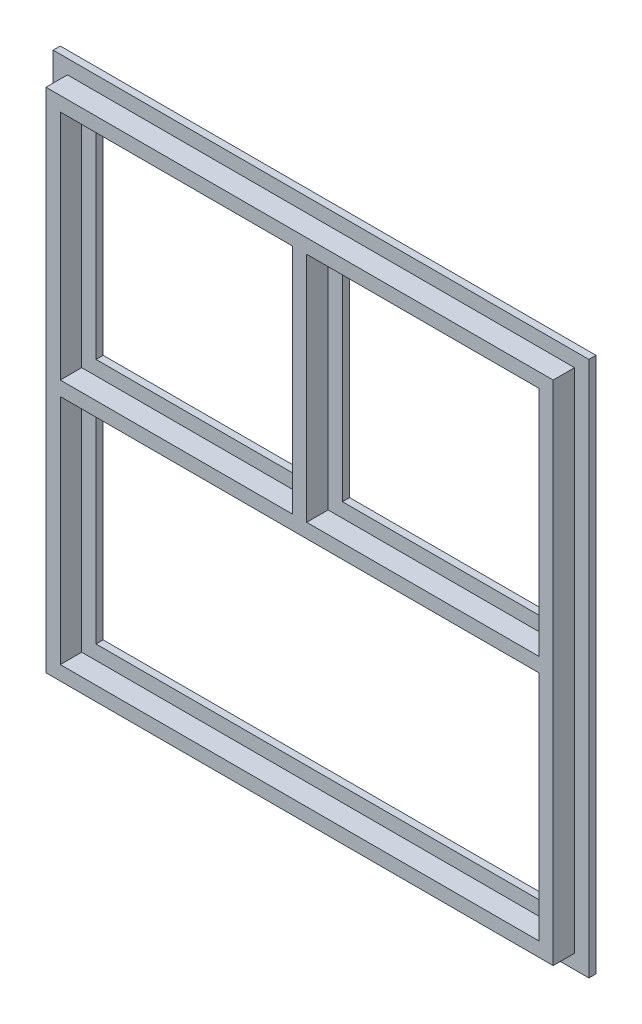
from build123d import *

# Parameters (mm, degrees)
ESBO_O1_W                = 75
ESBO_O1_H                = 75
RESSALTO_EXTRUS_O1_DEPTH = 1
ESBO_O2_W                = 71
ESBO_O2_H                = 71
ESBO_O2_W_2              = 67
ESBO_O2_H_2              = 67
RESSALTO_EXTRUS_O2_DEPTH = 3
ESBO_O3_W                = 28.5
ESBO_O3_H                = 28.5
ESBO_O3_W_2              = 63
CORTE_EXTRUS_O2_DEPTH    = 3
RESSALTO_EXTRUS_O3_DEPTH = 3


with BuildPart() as part:
    # Esboço1 → Ressalto-extrusão1 (new body)
    with BuildSketch(Plane.XY):
        Rectangle(ESBO_O1_W, ESBO_O1_H)
    extrude(amount=RESSALTO_EXTRUS_O1_DEPTH)

    # Esboço2 → Ressalto-extrusão2 (add)
    with BuildSketch(Plane.XY.offset(1)):
        Rectangle(ESBO_O2_W, ESBO_O2_H)
        Rectangle(ESBO_O2_W_2, ESBO_O2_H_2, mode=Mode.SUBTRACT)
    extrude(amount=RESSALTO_EXTRUS_O2_DEPTH)

    # Esboço3 → Corte-extrusão2 (cut)
    with BuildSketch(Plane.XY.offset(1)):
        with Locations((17.25, 17.25)):
            Rectangle(ESBO_O3_W, ESBO_O3_H)
        with Locations((0, -17.25)):
            Rectangle(ESBO_O3_W_2, ESBO_O3_H)
        with Locations((-17.25, 17.25)):
            Rectangle(ESBO_O3_W, ESBO_O3_H)
    extrude(amount=-CORTE_EXTRUS_O2_DEPTH, mode=Mode.SUBTRACT)

    # Esboço4 → Ressalto-extrusão3 (add)
    with BuildSketch(Plane.XY.offset(1)):
        Polygon((0, 33.5), (-1, 33.5), (-1, 1), (-33.5, 1), (-33.5, 0), (-33.5, -1), (33.5, -1), (33.5, 0), (33.5, 1), (1, 1), (1, 33.5), align=None)
    extrude(amount=RESSALTO_EXTRUS_O3_DEPTH)


solid = part.part
